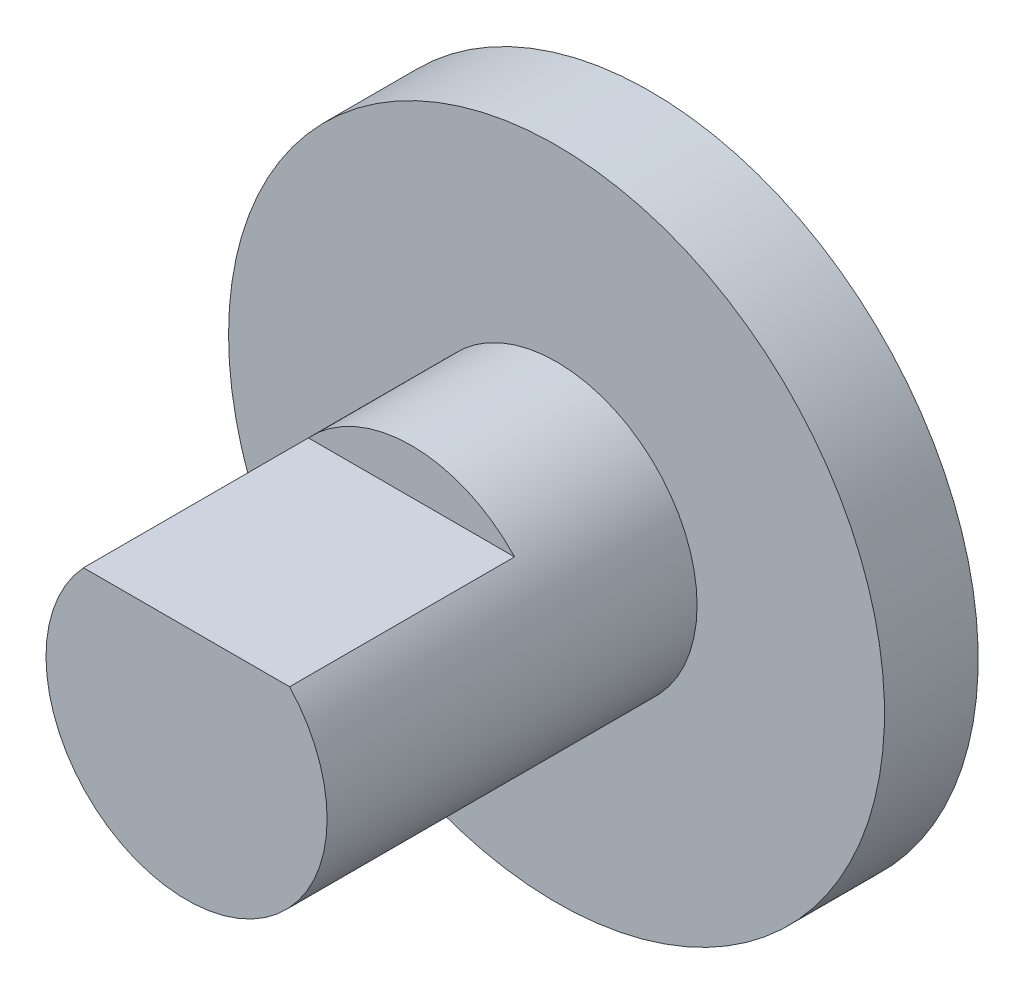
from build123d import *

# Parameters (mm, degrees)
SKETCH1_R           = 7.5
BOSS_EXTRUDE1_DEPTH = 19.74
SKETCH2_R           = 17.5
BOSS_EXTRUDE2_DEPTH = 5
CUT_EXTRUDE1_START  = -12
CUT_EXTRUDE1_DEPTH  = 12


with BuildPart() as part:
    # Sketch1 → Boss-Extrude1 (new body)
    with BuildSketch(Plane.XY):
        Circle(SKETCH1_R)
    extrude(amount=BOSS_EXTRUDE1_DEPTH)

    # Sketch2 → Boss-Extrude2 (add)
    with BuildSketch(Plane(origin=(0, 0, 0), x_dir=(-1, 0, 0), z_dir=(0, 0, -1))):
        Circle(SKETCH2_R)
    extrude(amount=BOSS_EXTRUDE2_DEPTH)

    # Sketch3 → Cut-Extrude1 (cut)
    with BuildSketch(Plane.XY.offset(19.74).offset(CUT_EXTRUDE1_START)):
        with BuildLine():
            Line((-5.499090834, 5.1), (5.499090834, 5.1))
            ThreePointArc((5.499090834, 5.1), (0, 7.5), (-5.499090834, 5.1))
        make_face()
    extrude(amount=CUT_EXTRUDE1_DEPTH, mode=Mode.SUBTRACT)


solid = part.part
